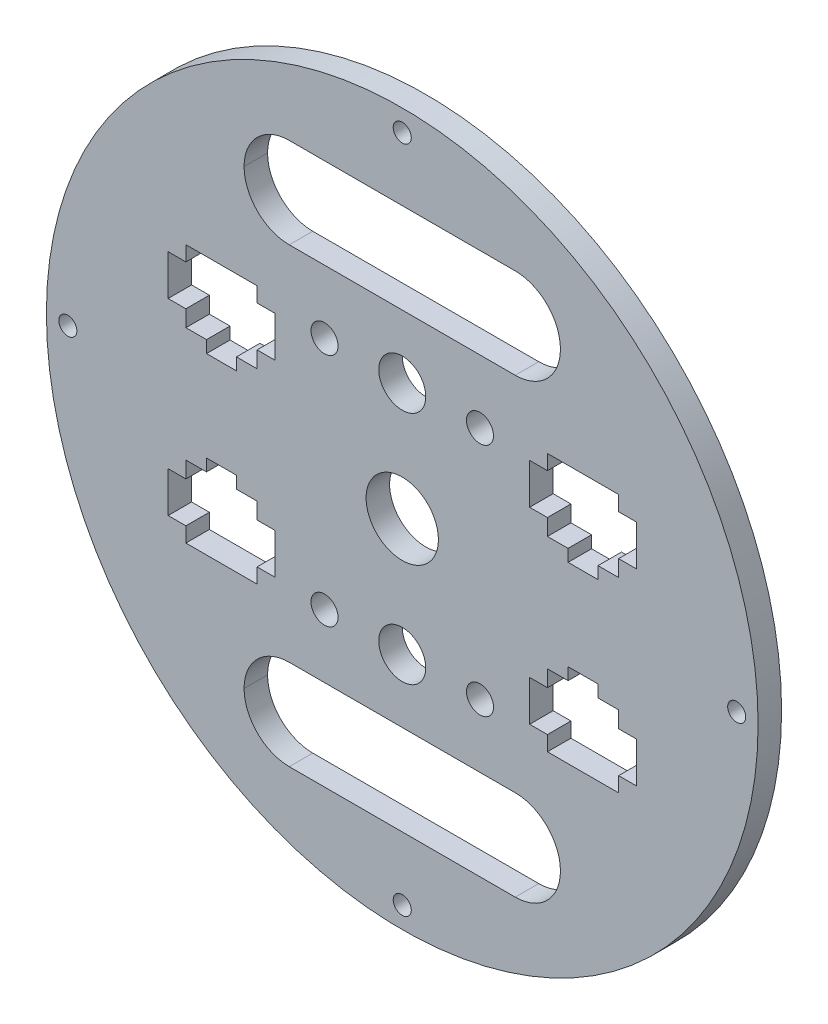
from build123d import *

# Parameters (mm, degrees)
SKETCH_1_R           = 50
EXTRUDE_1_DEPTH      = 3.302
SKETCH_4_R           = 5.08
CUT_EXTRUDE_3_DEPTH  = 71.787733429
SKETCH_7_R           = 1.27
CUT_EXTRUDE_6_DEPTH  = 71.787733429
SKETCH3_R            = 3.302
SKETCH3_R_2          = 1.9
CUT_EXTRUDE1_DEPTH   = 71.787733429
CUT_EXTRUDE4_DEPTH   = 71.787733429
MIRROR5_COPY_1_DEPTH = 71.787733429
SKETCH11_W           = 44.45
SKETCH11_H           = 12.7
CUT_EXTRUDE5_DEPTH   = 71.787733429
FILLET1_R            = 6.35
FILLET1_OF_MIRROR6_R = 6.35


with BuildPart() as part:
    # 草图1 → 凸台-拉伸1 (new body)
    with BuildSketch(Plane.XY):
        with Locations(Location((0, 0, 0), (0, 0, 180))):
            Circle(SKETCH_1_R)
    extrude(amount=EXTRUDE_1_DEPTH)

    # 草图4 → 切除-拉伸3 (cut, through all)
    with BuildSketch(Plane.XY.offset(3.302)):
        Circle(SKETCH_4_R)
    extrude(amount=-CUT_EXTRUDE_3_DEPTH, mode=Mode.SUBTRACT)

    # 草图7 → 切除-拉伸6 (cut, through all)
    with BuildSketch(Plane.XY.offset(3.302)):
        with Locations((0, 46.99)):
            Circle(SKETCH_7_R)
        with Locations((46.99, 0)):
            Circle(SKETCH_7_R)
        with Locations((0, -46.99)):
            Circle(SKETCH_7_R)
        with Locations((-46.99, 0)):
            Circle(SKETCH_7_R)
    extrude(amount=-CUT_EXTRUDE_6_DEPTH, mode=Mode.SUBTRACT)

    # Sketch3 → Cut-Extrude1 (cut, through all)
    with BuildSketch(Plane.XY.offset(3.302)):
        with Locations((0, 16.51)):
            Circle(SKETCH3_R)
        with Locations((10.922, 16.51)):
            Circle(SKETCH3_R_2)
        with Locations((-10.922, 16.51)):
            Circle(SKETCH3_R_2)
    cut_extrude1 = extrude(amount=-CUT_EXTRUDE1_DEPTH, mode=Mode.SUBTRACT)

    # Mirror3: Cut-Extrude1 across plane
    add(cut_extrude1.mirror(Plane.ZX), mode=Mode.SUBTRACT)

    # Sketch10 → Cut-Extrude4 (cut, through all)
    with BuildSketch(Plane.XY.offset(3.302)):
        Polygon((-20.4, -18.153199914), (-30.4, -18.153199914), (-30.4, -16.054784248), (-32.9, -16.054784248), (-32.9, -10.353195448), (-30.4, -10.353195448), (-30.4, -8.051599848), (-27.501596, -8.051599848), (-27.501596, -6.35), (-23.298404, -6.35), (-23.298404, -8.051599848), (-20.4, -8.051599848), (-20.4, -10.353195448), (-17.9, -10.353195448), (-17.9, -16.054784248), (-20.4, -16.054784248), align=None)
    cut_extrude4 = extrude(amount=-CUT_EXTRUDE4_DEPTH, mode=Mode.SUBTRACT)

    # Mirror4: Cut-Extrude4 across plane
    add(cut_extrude4.mirror(Plane.ZX), mode=Mode.SUBTRACT)

    # Mirror5: Cut-Extrude4 across plane
    add(cut_extrude4.mirror(Plane(origin=(0, 0, 0), x_dir=(0, 0, 1), z_dir=(1, 0, 0))), mode=Mode.SUBTRACT)

    # Mirror5 copy 1 sketch → Mirror5 copy 1 (cut, through all)
    with BuildSketch(Plane(origin=(0, 0, 3.302), x_dir=(-1, 0, 0), z_dir=(0, 0, 1))):
        Polygon((-20.4, -18.153199914), (-30.4, -18.153199914), (-30.4, -16.054784248), (-32.9, -16.054784248), (-32.9, -10.353195448), (-30.4, -10.353195448), (-30.4, -8.051599848), (-27.501596, -8.051599848), (-27.501596, -6.35), (-23.298404, -6.35), (-23.298404, -8.051599848), (-20.4, -8.051599848), (-20.4, -10.353195448), (-17.9, -10.353195448), (-17.9, -16.054784248), (-20.4, -16.054784248), align=None)
    extrude(amount=-MIRROR5_COPY_1_DEPTH, mode=Mode.SUBTRACT)

    # Sketch11 → Cut-Extrude5 (cut, through all)
    with BuildSketch(Plane.XY.offset(3.302)):
        with Locations((0, 31.75)):
            Rectangle(SKETCH11_W, SKETCH11_H)
    cut_extrude5 = extrude(amount=-CUT_EXTRUDE5_DEPTH, mode=Mode.SUBTRACT)

    # Fillet1
    fillet1_edges = [part.edges().sort_by_distance(p)[0] for p in [
        (22.225, 25.4, 1.651),
        (22.225, 38.1, 1.651),
        (-22.225, 38.1, 1.651),
        (-22.225, 25.4, 1.651),
    ]]
    fillet(fillet1_edges, radius=FILLET1_R - 0.0001)  # a hair under: the kernel refuses the full size

    # Mirror6: Cut-Extrude5 across plane
    add(cut_extrude5.mirror(Plane.ZX), mode=Mode.SUBTRACT)

    # Fillet1 of Mirror6
    fillet1_of_mirror6_edges = [part.edges().sort_by_distance(p)[0] for p in [
        (22.225, -25.4, 1.651),
        (22.225, -38.1, 1.651),
        (-22.225, -38.1, 1.651),
        (-22.225, -25.4, 1.651),
    ]]
    fillet(fillet1_of_mirror6_edges, radius=FILLET1_OF_MIRROR6_R - 0.0001)  # a hair under: the kernel refuses the full size


solid = part.part
